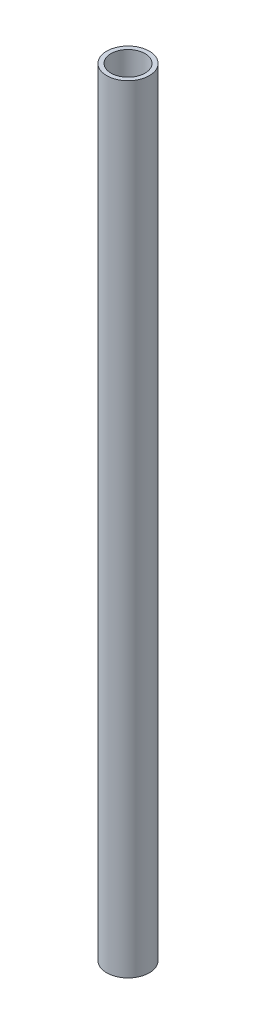
from build123d import *

# Parameters (mm, degrees)
SKETCH1_R           = 16.7005
SKETCH1_R_2         = 13.3223
BOSS_EXTRUDE1_DEPTH = 609.6


with BuildPart() as part:
    # Sketch1 → Boss-Extrude1 (new body)
    with BuildSketch(Plane(origin=(0, 0, 0), x_dir=(1, 0, 0), z_dir=(0, 1, 0))):
        Circle(SKETCH1_R)
        Circle(SKETCH1_R_2, mode=Mode.SUBTRACT)
    extrude(amount=BOSS_EXTRUDE1_DEPTH)


solid = part.part
